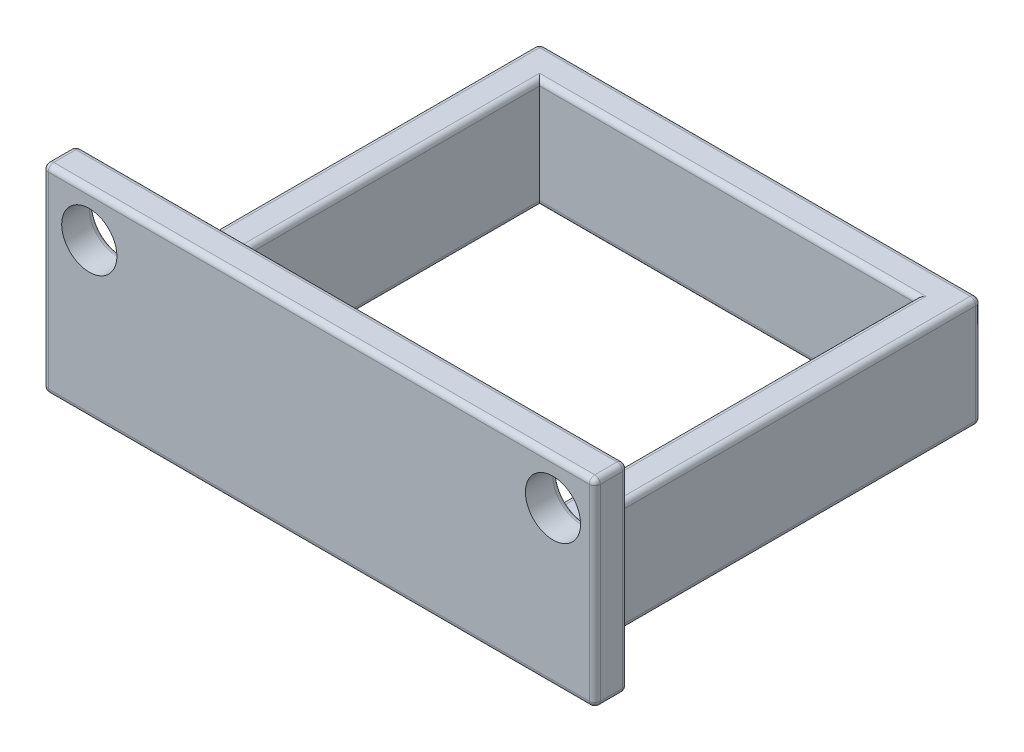
from build123d import *

# Parameters (mm, degrees)
SKETCH_2_W          = 34
SKETCH_2_H          = 34
EXTRUDE_1_DEPTH     = 10
SKETCH_2_3_W        = 50
SKETCH_2_3_H        = 3
EXTRUDE_2_DEPTH     = 18
SKETCH_4_R          = 2.5
CUT_EXTRUDE_1_DEPTH = 20
FILLET_1_R          = 0.5


with BuildPart() as part:
    # 草图2 → 凸台-拉伸1 (new body)
    with BuildSketch(Plane(origin=(0, 0, 0), x_dir=(1, 0, 0), z_dir=(0, 1, 0))):
        Polygon((25, -20), (25, -17), (20, -17), (20, 20), (-20, 20), (-20, -17), (-25, -17), (-25, -20), align=None)
        Rectangle(SKETCH_2_W, SKETCH_2_H, mode=Mode.SUBTRACT)
    extrude(amount=EXTRUDE_1_DEPTH)

    # 草图2<3> → 凸台-拉伸2 (add)
    with BuildSketch(Plane(origin=(0, 0, 0), x_dir=(1, 0, 0), z_dir=(0, 1, 0))):
        with Locations((0, -18.5)):
            Rectangle(SKETCH_2_3_W, SKETCH_2_3_H)
    extrude(amount=EXTRUDE_2_DEPTH)

    # 草图4 → 切除-拉伸1 (cut)
    with BuildSketch(Plane(origin=(0, 0, 17), x_dir=(-1, 0, 0), z_dir=(0, 0, -1))):
        with Locations((-21.214140071, 14)):
            Circle(SKETCH_4_R)
        with Locations((20.785859929, 14)):
            Circle(SKETCH_4_R)
    extrude(amount=-CUT_EXTRUDE_1_DEPTH, mode=Mode.SUBTRACT)

    # 圆角1
    fillet_1_edges = [part.edges().sort_by_distance(p)[0] for p in [
        (-25, 9, 20),
        (25, 9, 20),
        (0, 18, 20),
        (-25, 18, 18.5),
        (25, 18, 18.5),
        (-25, 0, 18.5),
        (0, 0, 20),
        (25, 0, 18.5),
        (20, 0, -1.5),
        (-20, 0, -1.5),
        (0, 0, -17),
        (17, 0, 0),
        (-17, 0, 0),
        (20, 10, -1.5),
        (17, 10, 0),
        (0, 10, -17),
        (-17, 10, 0),
        (-20, 10, -1.5),
        (20, 5, -20),
        (0, 10, -20),
        (-20, 5, -20),
        (0, 0, -20),
        (17, 5, 17),
        (18.5, 10, 17),
        (20, 5, 17),
        (22.5, 0, 17),
        (25, 9, 17),
        (0, 18, 17),
        (-25, 9, 17),
        (-22.5, 0, 17),
        (-20, 5, 17),
        (-18.5, 10, 17),
        (-17, 5, 17),
        (0, 0, 17),
        (-18.285859929, 14, 17),
        (23.714140071, 14, 17),
    ]]
    fillet(fillet_1_edges, radius=FILLET_1_R)


solid = part.part
